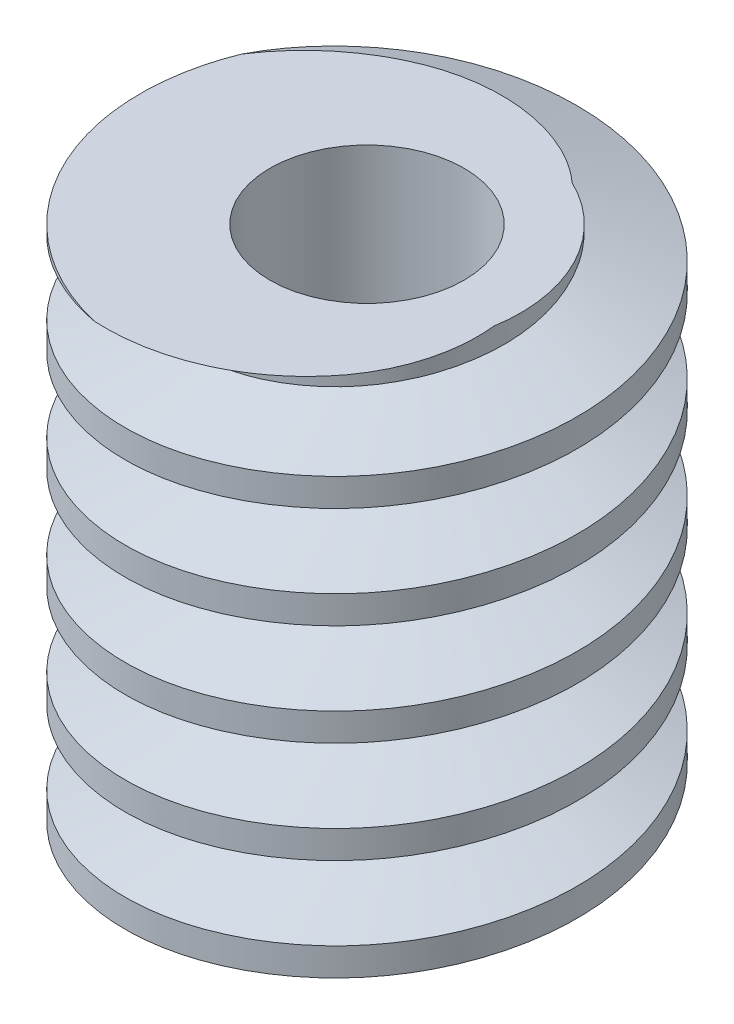
from build123d import *

# Parameters (mm, degrees)
SKETCH1_R           = 2.375
SKETCH1_R_2         = 1.5
BOSS_EXTRUDE1_DEPTH = 8
SWEEP1_PITCH        = 1.5708
SPLIT1_START        = -4
SPLIT1_OUTLINE_W    = 9
SPLIT1_OUTLINE_H    = 4
SPLIT1_OUTLINE_H_2  = 3
SPLIT1_DEPTH        = 8


with BuildPart() as part:
    # Sketch1 → Boss-Extrude1 (new body)
    with BuildSketch(Plane(origin=(0, 0, 0), x_dir=(1, 0, 0), z_dir=(0, 1, 0))):
        with Locations(Location((0, 0, 0), (0, 0, 270))):
            Circle(SKETCH1_R)
        with Locations(Location((0, 0, 0), (0, 0, 270))):
            Circle(SKETCH1_R_2, mode=Mode.SUBTRACT)
    extrude(amount=BOSS_EXTRUDE1_DEPTH)

    # Sweep1: arcs per turn and ends read off the stored shape
    # Sweep1: the profile of Sketch3 profile screwed along a right-hand helix through 7 turns, 8 arcs to a turn; built about Z, then put on its axis
    sweep1_z = Axis((0, 0, 0), (0, 0, 1))
    sweep1_corners = [(3.499780337, -8.552e-06, 0.430000021), (2.3747, -5.802e-06, 0.839495775), (2.3747, -5.802e-06, -0.409495733), (3.499780337, -8.552e-06, 2.1e-08)]
    with BuildLine(mode=Mode.PRIVATE) as sweep1_profile:
        Line(sweep1_corners[0], sweep1_corners[1])
        Line(sweep1_corners[1], sweep1_corners[2])
        Line(sweep1_corners[2], sweep1_corners[3])
        Line(sweep1_corners[3], sweep1_corners[0])
    sweep1_cap = Face(sweep1_profile.wire())
    sweep1_turn_angles = [0, 22.5, 45, 67.5, 90, 112.5, 135, 157.5, 180, 202.5, 225, 247.5, 270, 292.5, 315, 337.5, 360]
    sweep1_turn_weights = [1, 0.9238795325112867, 1, 0.9238795325112867, 1, 0.9238795325112867, 1, 0.9238795325112867, 1, 0.9238795325112867, 1, 0.9238795325112867, 1, 0.9238795325112867, 1, 0.9238795325112867, 1]
    sweep1_turn_rails = [Edge.make_bspline([Vector(p[0], p[1], 0).rotate(sweep1_z, sweep1_turn_angles[k]) / sweep1_turn_weights[k] + Vector(0, 0, p[2] + SWEEP1_PITCH * sweep1_turn_angles[k] / 360) for k in range(17)], [0, 0, 0, 1, 1, 2, 2, 3, 3, 4, 4, 5, 5, 6, 6, 7, 7, 8, 8, 8], 2, sweep1_turn_weights) for p in sweep1_corners]
    sweep1_turn_sides = [Face.make_surface_from_curves(sweep1_turn_rails[p[0]], sweep1_turn_rails[p[1]]) for p in [(0, 1), (1, 2), (2, 3), (3, 0)]]
    sweep1 = Plane(origin=(0, -2, 0), x_dir=(-0.5735764363510527, 0, -0.8191520442889871), z_dir=(0, 1, 0)) * Solid(Shell([*[p.moved(Location((0, 0, SWEEP1_PITCH * i))) for i in range(7) for p in sweep1_turn_sides], sweep1_cap, sweep1_cap.rotate(sweep1_z, 2520).moved(Location((0, 0, SWEEP1_PITCH * 2520 / 360)))]))
    add(sweep1)

    # Split1: read off the stored shape, not the designer's step
    # Split1 outline → Split1 (cut)
    with BuildSketch(Plane(origin=(0, 0, 0), x_dir=(0.8191534945182253, 0, -0.5735743652034843), z_dir=(0.5735743652034843, 0, 0.8191534945182253)).offset(SPLIT1_START)):
        with Locations((-0.5, -2)):
            Rectangle(SPLIT1_OUTLINE_W, SPLIT1_OUTLINE_H)
        with Locations((-0.5, 9.5)):
            Rectangle(SPLIT1_OUTLINE_W, SPLIT1_OUTLINE_H_2)
    extrude(amount=SPLIT1_DEPTH, mode=Mode.SUBTRACT)


solid = part.part
